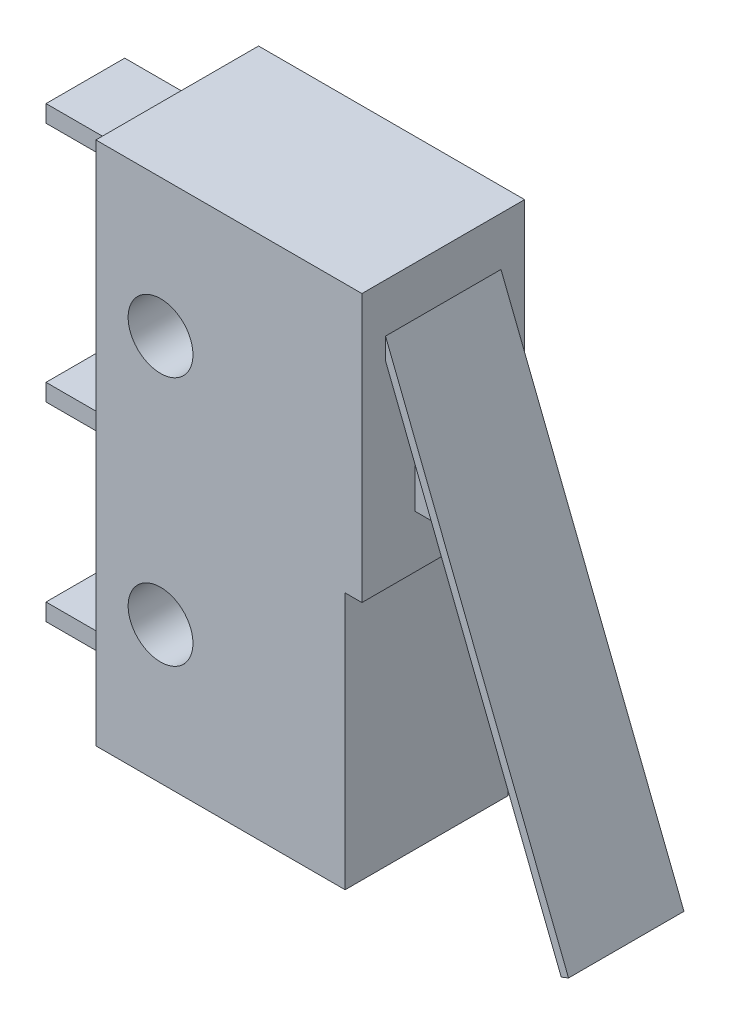
from build123d import *

# Parameters (mm, degrees)
BOSS_EXTRUDE1_DEPTH      = 6.2
SKETCH2_W                = 3
SKETCH2_H                = 0.65
BOSS_EXTRUDE2_DEPTH      = 3.5
BOSS_EXTRUDE2_2_DEPTH    = 3.5
BOSS_EXTRUDE2_3_DEPTH    = 3.5
SKETCH3_R                = 1.235
CUT_EXTRUDE1_DEPTH       = 6.2
SKETCH4_W                = 2.25
SKETCH4_H                = 1.5
BOSS_EXTRUDE4_DEPTH      = 2
FILLET1_R                = 1
BOSS_EXTRUDE5_DEPTH      = 2.2
BOSS_EXTRUDE5_DEPTH_BACK = 2.2


with BuildPart() as part:
    # Sketch1 → Boss-Extrude1 (new body)
    with BuildSketch(Plane.XY):
        Polygon((-2.51649635, -0.377007299), (-3.15649635, -0.377007299), (-3.15649635, -10.177007299), (-12.65649635, -10.177007299), (-12.65649635, 9.822992701), (-2.51649635, 9.822992701), align=None)
    extrude(amount=BOSS_EXTRUDE1_DEPTH)

    # Sketch3 → Cut-Extrude1 (cut)
    with BuildSketch(Plane.XY.offset(6.2)):
        with Locations((-10.19149635, 4.582992701)):
            Circle(SKETCH3_R)
        with Locations((-10.19149635, -4.942007299)):
            Circle(SKETCH3_R)
    extrude(amount=-CUT_EXTRUDE1_DEPTH, mode=Mode.SUBTRACT)

    # Sketch4 → Boss-Extrude4 (add)
    with BuildSketch(Plane(origin=(-2.51649635, 0, 0), x_dir=(0, 0, -1), z_dir=(1, 0, 0))):
        with Locations((-3.05, 2.372992701)):
            Rectangle(SKETCH4_W, SKETCH4_H)
    extrude(amount=BOSS_EXTRUDE4_DEPTH)

    # Fillet1
    # the kernel refuses this fillet: 1 mm, written as the material it takes off along each edge
    with BuildSketch(Plane(origin=(-0.51649635, 3.122992701, 6.675), x_dir=(-1, 0, 0), z_dir=(0, 0, -1)), Plane(origin=(-0.51649635, 1.622992701, -0.575), x_dir=(-1, 0, 0), z_dir=(0, 0, 1))) as fillet1_piece_1:
        with BuildLine():
            CenterArc((FILLET1_R, -FILLET1_R), FILLET1_R, 90, 90)
            Line((0, -FILLET1_R), (0, 0))
            Line((0, 0), (FILLET1_R, 0))
        make_face()
    extrude(amount=7.25, mode=Mode.SUBTRACT)


with BuildPart() as body_2:
    # Sketch2 → Boss-Extrude2 (new body)
    with BuildSketch(Plane.ZY.offset(12.65649635)):
        with Locations((3.1, 8.147992701)):
            Rectangle(SKETCH2_W, SKETCH2_H)
    extrude(amount=BOSS_EXTRUDE2_DEPTH)


with BuildPart() as body_3:
    # Sketch2 → Boss-Extrude2 2 (new body)
    with BuildSketch(Plane.ZY.offset(12.65649635)):
        with Locations((3.1, -1.052007299)):
            Rectangle(SKETCH2_W, SKETCH2_H)
    extrude(amount=BOSS_EXTRUDE2_2_DEPTH)


with BuildPart() as body_4:
    # Sketch2 → Boss-Extrude2 3 (new body)
    with BuildSketch(Plane.ZY.offset(12.65649635)):
        with Locations((3.1, -8.302007299)):
            Rectangle(SKETCH2_W, SKETCH2_H)
    extrude(amount=BOSS_EXTRUDE2_3_DEPTH)


with BuildPart() as body_5:
    # Sketch5 → Boss-Extrude5 (new, two sides: drawn at the far end of the back side and taken through both)
    with BuildSketch(Plane.XY.offset(3.1).offset(-BOSS_EXTRUDE5_DEPTH_BACK)):
        Polygon((-2.51649635, 7.968450239), (4.457309504, -9.731345212), (4.17819322, -9.841318391), (-2.795612634, 7.85847706), align=None)
    extrude(amount=BOSS_EXTRUDE5_DEPTH + BOSS_EXTRUDE5_DEPTH_BACK)


solid = Compound([part.part, body_2.part, body_3.part, body_4.part, body_5.part])
